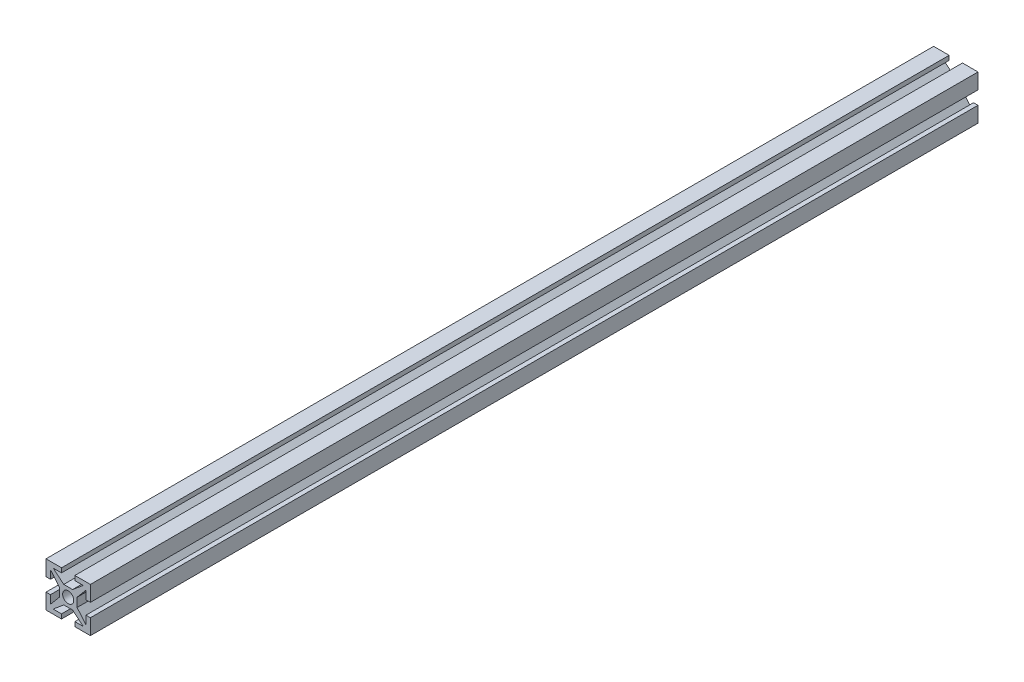
from build123d import *

# Parameters (mm, degrees)
ESQUISSE2_R          = 1.25
MAIN_EXTRUSION_DEPTH = 200


with BuildPart() as part:
    # Esquisse2 → Main Extrusion (new body)
    with BuildSketch(Plane.XY):
        Polygon((-1, -2), (1, -2), (3.383507185, -4), (1.5, -4), (1.5, -5), (5, -5), (5, -1.5), (4, -1.5), (4, -3.383507185), (2, -1), (2, 1), (4, 3.383507185), (4, 1.5), (5, 1.5), (5, 5), (1.5, 5), (1.5, 4), (3.383507185, 4), (1, 2), (-1, 2), (-3.383507185, 4), (-1.5, 4), (-1.5, 5), (-5, 5), (-5, 1.5), (-4, 1.5), (-4, 3.383507185), (-2, 1), (-2, -1), (-4, -3.383507185), (-4, -1.5), (-5, -1.5), (-5, -5), (-1.5, -5), (-1.5, -4), (-3.383507185, -4), align=None)
        Circle(ESQUISSE2_R, mode=Mode.SUBTRACT)
    extrude(amount=MAIN_EXTRUSION_DEPTH)


solid = part.part
